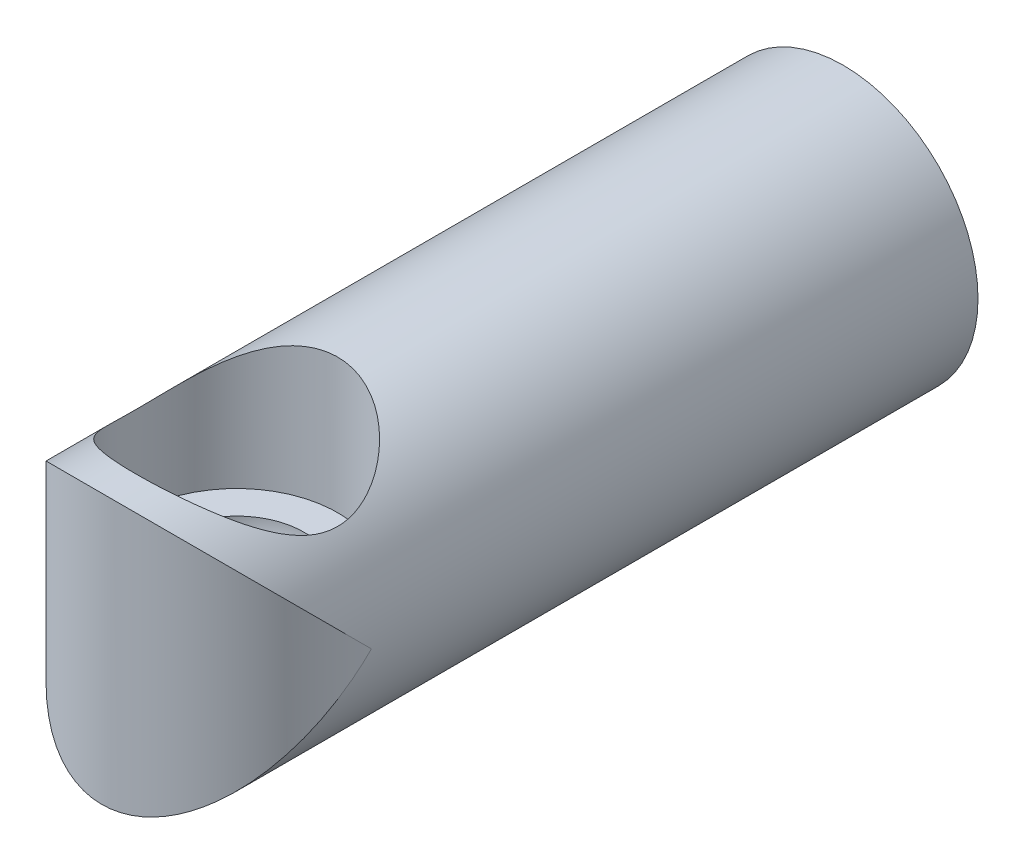
from build123d import *

# Parameters (mm, degrees)
BOSS_EXTRU_1_DEPTH       = 2
BOSS_EXTRU_1_DEPTH_BACK  = 5
ESQUISSE1_R              = 2
ESQUISSE1_R_2            = 1
BOSS_EXTRU_2_START       = 2
BOSS_EXTRU_2_OUTLINE_R   = 2
BOSS_EXTRU_2_DEPTH       = 2
BOSS_EXTRU_2_START_2     = 4
BOSS_EXTRU_2_2_OUTLINE_R = 2
BOSS_EXTRU_2_2_DEPTH     = 2
BOSS_EXTRU_2_START_3     = -3
BOSS_EXTRU_2_3_DEPTH     = 6
ENL_V_START              = -2
ESQUISSE4_R              = 1.5
ENL_V_MAT_EXTRU_1_DEPTH  = 2


with BuildPart() as part:
    # Esquisse1 → Boss.-Extru.1 (new, two sides: drawn at the far end of the back side and taken through both)
    with BuildSketch(Plane.XY.offset(-BOSS_EXTRU_1_DEPTH_BACK)):
        Circle(ESQUISSE1_R)
        Circle(ESQUISSE1_R_2, mode=Mode.SUBTRACT)
    extrude(amount=BOSS_EXTRU_1_DEPTH + BOSS_EXTRU_1_DEPTH_BACK)

    # Boss.-Extru.2: read off the stored shape, not the designer's step
    # Boss.-Extru.2 outline → Boss.-Extru.2 (add)
    with BuildSketch(Plane.XY.offset(BOSS_EXTRU_2_START)):
        Circle(BOSS_EXTRU_2_OUTLINE_R)
    extrude(amount=BOSS_EXTRU_2_DEPTH)

    # Boss.-Extru.2 2 outline → Boss.-Extru.2 2 (add)
    with BuildSketch(Plane.XY.offset(BOSS_EXTRU_2_START_2)):
        Circle(BOSS_EXTRU_2_2_OUTLINE_R)
    extrude(amount=BOSS_EXTRU_2_2_DEPTH)

    # Boss.-Extru.2 3 outline → Boss.-Extru.2 3 (cut)
    with BuildSketch(Plane(origin=(0, 0, 0), x_dir=(1, 0, 0), z_dir=(0, 1, 0)).offset(BOSS_EXTRU_2_START_3)):
        with BuildLine():
            Line((2, -3), (2, -4))
            ThreePointArc((2, -4), (1.414213562, -5.414213562), (0, -6))
            Line((0, -6), (3, -6))
            Line((3, -6), (3, -3))
            Line((3, -3), (2, -3))
        make_face()
        with BuildLine():
            Line((-3, -6), (0, -6))
            ThreePointArc((0, -6), (-1.414213562, -5.414213562), (-2, -4))
            Line((-2, -4), (-2, -3))
            Line((-2, -3), (-3, -3))
            Line((-3, -3), (-3, -6))
        make_face()
    extrude(amount=BOSS_EXTRU_2_3_DEPTH, mode=Mode.SUBTRACT)

    # Esquisse3 → Enlèvement de matière-Révolution1 (revolve, cut)
    with BuildSketch(Plane(origin=(0, 0, 0), x_dir=(0, 0, -1), z_dir=(1, 0, 0))):
        with BuildLine():
            Line((-4, -1), (-4, 1))
            ThreePointArc((-4, 1), (-3, 0), (-4, -1))
        make_face()
    revolve(axis=Axis((0, -1, 4), (0, 1, 0)), mode=Mode.SUBTRACT)

    # Esquisse4 → Enlèv. mat.-Extru.1 (cut)
    with BuildSketch(Plane(origin=(0, 2, 0), x_dir=(1, 0, 0), z_dir=(0, 1, 0)).offset(ENL_V_START)):
        with Locations(Location((0, -4, 0), (0, 0, 270))):
            Circle(ESQUISSE4_R)
    extrude(amount=ENL_V_MAT_EXTRU_1_DEPTH, mode=Mode.SUBTRACT)


solid = part.part
